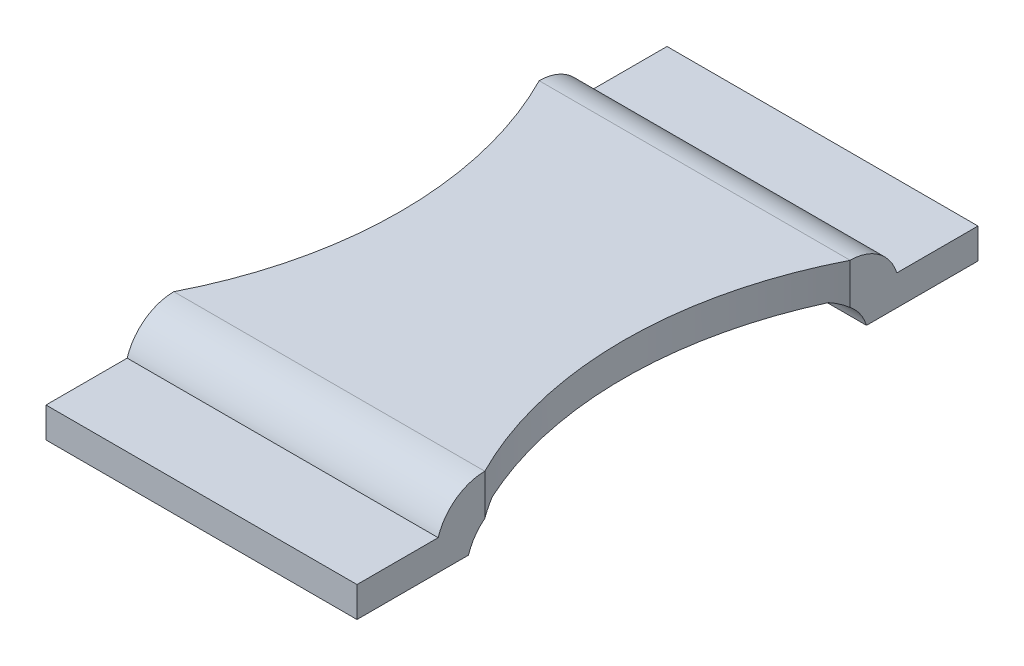
from build123d import *

# Parameters (mm, degrees)
BOSS_EXTRUDE1_DEPTH     = 1.59
FILLET1_START           = -1.59
FILLET1_DEPTH           = 3.18
FILLET1_2_DEPTH         = 3.18
CUT_EXTRUDE1_DEPTH      = 4.611692816
CUT_EXTRUDE2_DEPTH      = 4.611692879
CUT_EXTRUDE2_DEPTH_BACK = 4.611692879
BOSS_EXTRUDE2_START     = -0.336291
BOSS_EXTRUDE2_DEPTH     = 0.336291


with BuildPart() as part:
    # Sketch1 → Boss-Extrude1 (new, symmetric)
    with BuildSketch(Plane(origin=(0, 0, 0), x_dir=(0, 0, -1), z_dir=(1, 0, 0))):
        Polygon((3.175, 0), (2.035, 0), (2.035, 0.35), (-2.035, 0.35), (-2.035, 0), (-3.175, 0), (-3.175, 0.31), (-2.345, 0.31), (-2.345, 0.66), (2.345, 0.66), (2.345, 0.31), (3.175, 0.31), align=None)
    extrude(amount=BOSS_EXTRUDE1_DEPTH, both=True)

    # Fillet1: read off the stored shape, not the designer's step
    # Fillet1 outline → Fillet1 (cut)
    with BuildSketch(Plane.YZ.offset(FILLET1_START)):
        with BuildLine():
            ThreePointArc((0.31, 2.345), (0.563112887, 2.163834388), (0.66, 1.868030399))
            Line((0.66, 1.868030399), (0.66, 2.345))
            Line((0.66, 2.345), (0.31, 2.345))
        make_face()
        with BuildLine():
            ThreePointArc((0.66, -1.868030399), (0.563112887, -2.163834388), (0.31, -2.345))
            Line((0.31, -2.345), (0.66, -2.345))
            Line((0.66, -2.345), (0.66, -1.868030399))
        make_face()
    extrude(amount=FILLET1_DEPTH, mode=Mode.SUBTRACT)

    # Fillet1 2 outline → Fillet1 2 (add)
    with BuildSketch(Plane.YZ.offset(FILLET1_START)):
        with BuildLine():
            Line((0.35, 2.035), (0, 2.035))
            ThreePointArc((0, 2.035), (0.253112887, 1.853834388), (0.35, 1.558030399))
            Line((0.35, 1.558030399), (0.35, 2.035))
        make_face()
        with BuildLine():
            Line((0.35, -2.035), (0.35, -1.558030399))
            ThreePointArc((0.35, -1.558030399), (0.253112887, -1.853834388), (0, -2.035))
            Line((0, -2.035), (0.35, -2.035))
        make_face()
    extrude(amount=FILLET1_2_DEPTH)

    # Sketch3 → Cut-Extrude1 (cut, symmetric)
    with BuildSketch(Plane(origin=(0, 0.66, 0), x_dir=(1, 0, 0), z_dir=(0, 1, 0))):
        with BuildLine():
            Line((-1.59, -1.868030399), (-1.59, 1.868030399))
            ThreePointArc((-1.59, 1.868030399), (-1.14113305, 0), (-1.59, -1.868030399))
        make_face()
    cut_extrude1 = extrude(amount=CUT_EXTRUDE1_DEPTH, both=True, mode=Mode.SUBTRACT)

    # Mirror1: Cut-Extrude1 across plane
    add(cut_extrude1.mirror(Plane(origin=(0, 0, 0), x_dir=(0, 0, 1), z_dir=(1, 0, 0))), mode=Mode.SUBTRACT)

    # Sketch4 → Cut-Extrude2 (cut, two sides: drawn at the far end of the back side and taken through both)
    with BuildSketch(Plane(origin=(0, 0.66, 0), x_dir=(1, 0, 0), z_dir=(0, 1, 0)).offset(-CUT_EXTRUDE2_DEPTH_BACK)):
        with BuildLine():
            Line((-1.517289395, -1.718030399), (1.517289395, -1.718030399))
            ThreePointArc((1.517289395, -1.718030399), (1.14113305, 0), (1.517289395, 1.718030399))
            Line((1.517289395, 1.718030399), (-1.517289395, 1.718030399))
            ThreePointArc((-1.517289395, 1.718030399), (-1.14113305, 0), (-1.517289395, -1.718030399))
        make_face()
    extrude(amount=CUT_EXTRUDE2_DEPTH + CUT_EXTRUDE2_DEPTH_BACK, mode=Mode.SUBTRACT)


with BuildPart() as cut_extrude2_piece_1:
    # of the separate pieces the step leaves, piece 1, a body of its own (cut_extrude2_pieces)
    add(part.part.solids().sort_by_distance((-1.59, 0, -3.175))[0])



with BuildPart() as cut_extrude2_piece_2:
    # of the separate pieces the step leaves, piece 2, a body of its own (cut_extrude2_pieces)
    add(part.part.solids().sort_by_distance((-1.59, 0.66, 1.868030399))[0])


with BuildPart() as cut_extrude2_piece_1_1:
    add(cut_extrude2_piece_1.part)

    add(cut_extrude2_piece_2.part)  # Boss-Extrude2 merges Cut-Extrude2 piece 2
    # Sketch4<2> → Boss-Extrude2 (add)
    with BuildSketch(Plane(origin=(0, 0.66, 0), x_dir=(1, 0, 0), z_dir=(0, 1, 0)).offset(BOSS_EXTRUDE2_START)):
        with BuildLine():
            Line((-1.517289395, -1.718030399), (1.517289395, -1.718030399))
            ThreePointArc((1.517289395, -1.718030399), (1.14113305, 0), (1.517289395, 1.718030399))
            Line((1.517289395, 1.718030399), (-1.517289395, 1.718030399))
            ThreePointArc((-1.517289395, 1.718030399), (-1.14113305, 0), (-1.517289395, -1.718030399))
        make_face()
    extrude(amount=BOSS_EXTRUDE2_DEPTH)


solid = cut_extrude2_piece_1_1.part
